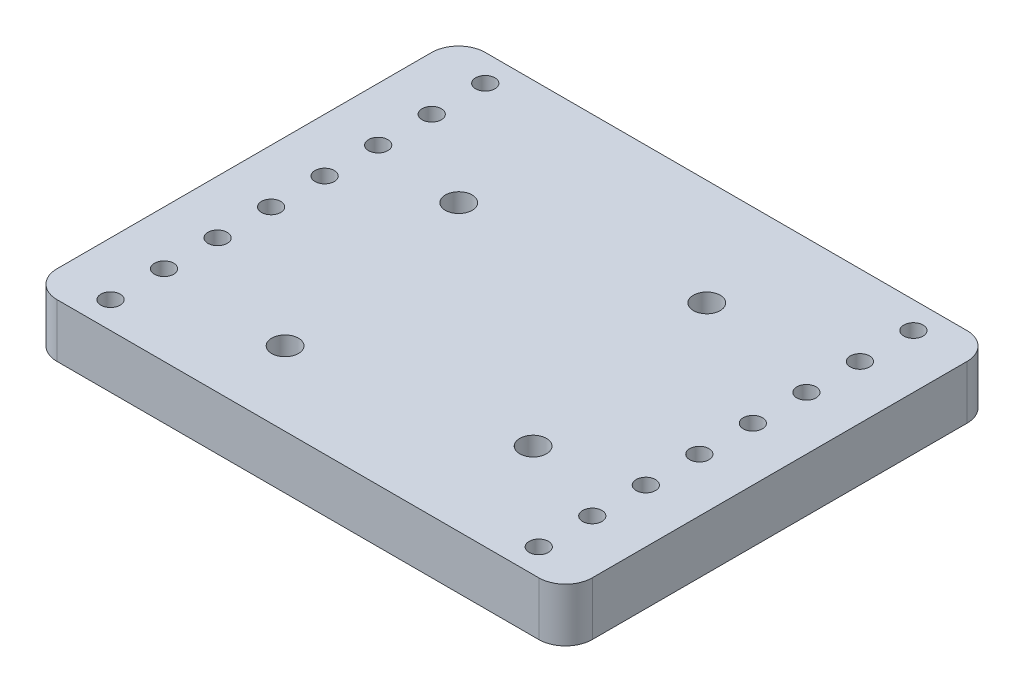
from build123d import *

# Parameters (mm, degrees)
SKETCH1_W                   = 127
SKETCH1_H                   = 101.6
INITIAL_PLATE_DEPTH         = 12.7
SKETCH2_R                   = 3.175
BEARING_STACK_HOLES_DEPTH   = 83.30540687
SKETCH3_R                   = 2.286
INITIAL_MOUNTING_HOLE_DEPTH = 83.30540687
MOUNTING_PATTERN_COUNT      = 8
MOUNTING_PATTERN_PITCH      = 12.7
FILLET1_R                   = 6.35


with BuildPart() as part:
    # Sketch1 → Initial Plate (new body)
    with BuildSketch(Plane(origin=(0, 0, 0), x_dir=(1, 0, 0), z_dir=(0, 1, 0))):
        Rectangle(SKETCH1_W, SKETCH1_H)
    extrude(amount=INITIAL_PLATE_DEPTH)

    # Sketch2 → Bearing Stack Holes (cut, through all)
    with BuildSketch(Plane(origin=(0, 12.7, 0), x_dir=(1, 0, 0), z_dir=(0, 1, 0))):
        with Locations((-29.424780639, 16.793453214)):
            Circle(SKETCH2_R)
        with Locations((-20.603453214, -33.234780639)):
            Circle(SKETCH2_R)
        with Locations((29.424780639, -24.413453214)):
            Circle(SKETCH2_R)
        with Locations((20.603453214, 25.614780639)):
            Circle(SKETCH2_R)
    extrude(amount=-BEARING_STACK_HOLES_DEPTH, mode=Mode.SUBTRACT)

    # Sketch3 → Initial Mounting Hole (cut, through all)
    with BuildSketch(Plane(origin=(0, 12.7, 0), x_dir=(1, 0, 0), z_dir=(0, 1, 0))):
        with Locations((-50.8, -44.45)):
            Circle(SKETCH3_R)
        with Locations((50.8, -44.45)):
            Circle(SKETCH3_R)
    initial_mounting_hole = extrude(amount=-INITIAL_MOUNTING_HOLE_DEPTH, mode=Mode.SUBTRACT)

    # Mounting Pattern: Initial Mounting Hole ×8
    with Locations(*[(0, 0, -i * MOUNTING_PATTERN_PITCH) for i in range(1, MOUNTING_PATTERN_COUNT)]):
        add(initial_mounting_hole, mode=Mode.SUBTRACT)

    # Fillet1
    fillet1_edges = [part.edges().sort_by_distance(p)[0] for p in [
        (63.5, 6.35, -50.8),
        (63.5, 6.35, 50.8),
        (-63.5, 6.35, 50.8),
        (-63.5, 6.35, -50.8),
    ]]
    fillet(fillet1_edges, radius=FILLET1_R)


solid = part.part
